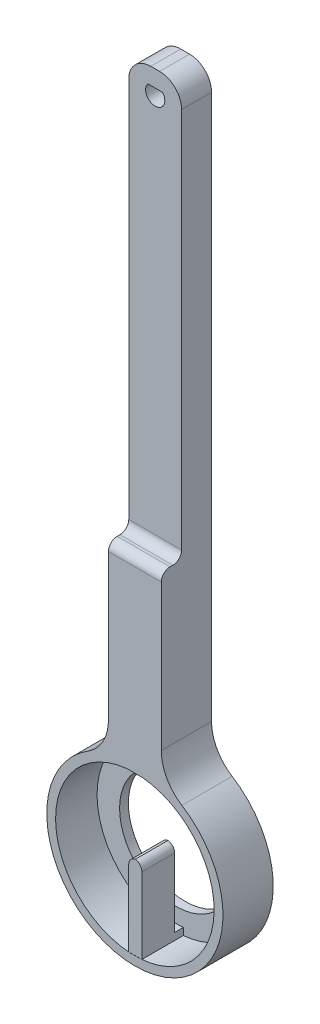
from build123d import *
from build123d.topology import SkipClean

# Parameters (mm, degrees)
BOSS_EXTRUDE1_DEPTH      = 13
BOSS_EXTRUDE1_2_DEPTH    = 13
BOSS_EXTRUDE2_DEPTH      = 13
CUT_EXTRUDE1_DEPTH       = 13
SKETCH3_W                = 6.626848164
SKETCH3_H                = 19.420298156
CUT_EXTRUDE2_DEPTH       = 13
FILLET1_R                = 10
SKETCH4_R                = 20
BOSS_EXTRUDE3_DEPTH      = 13
CUT_EXTRUDE3_DEPTH       = 13
SKETCH6_R                = 18
CUT_EXTRUDE4_DEPTH       = 24
BOSS_EXTRUDE7_DEPTH      = 22
FILLET5_R                = 1.75
FILLET6_R                = 20
SKETCH13_W               = 6.626848164
SKETCH13_H               = 84.326545424
CUT_EXTRUDE8_DEPTH       = 22
FILLET8_R                = 21.5
FILLET9_R                = 21.5
SKETCH14_W               = 17.060891399
SKETCH14_H               = 46.716771418
CUT_EXTRUDE10_DEPTH      = 22
SKETCH23_R               = 16.395826628
CUT_EXTRUDE14_DEPTH      = 4
BOSS_EXTRUDE16_DEPTH     = 2
SKETCH25_R               = 20.128500803
CUT_EXTRUDE15_DEPTH      = 9
SKETCH26_W               = 8.848519257
SKETCH26_H               = 26
CUT_EXTRUDE16_DEPTH      = 9
CUT_EXTRUDE17_DEPTH      = 9
FILLET21_R               = 3.5
SKETCH28_W               = 12
SKETCH28_H               = 42.572003563
BOSS_EXTRUDE20_DEPTH     = 15.8
BOSS_EXTRUDE21_START     = -6.8
SKETCH30_W               = 12
SKETCH30_H               = 93.599870645
BOSS_EXTRUDE21_DEPTH     = 6.8
FILLET23_R               = 5
BOSS_EXTRUDE22_DEPTH     = 6.8
CUT_EXTRUDE18_DEPTH      = 29
CUT_EXTRUDE18_DEPTH_BACK = 41
SKETCH34_W               = 5.585914081
SKETCH34_H               = 80.48337208
FILLET27_R               = 2
FILLET28_R               = 10
BOSS_EXTRUDE24_DEPTH     = 6.8


with BuildPart() as part:
    # Sketch1 → Boss-Extrude1 (new body)
    with BuildSketch(Plane.XY):
        with BuildLine():
            Line((4, -87.5), (-4, -87.5))
            Line((-4, -87.5), (-4, -67.904082058))
            ThreePointArc((-4, -67.904082058), (0, -107.5), (4, -67.904082058))
            Line((4, -67.904082058), (4, -87.5))
        make_face()
    extrude(amount=BOSS_EXTRUDE1_DEPTH)



with BuildPart() as body_2:
    # Sketch1 → Boss-Extrude1 2 (new body)
    with BuildSketch(Plane.XY):
        with BuildLine():
            Line((-4, 87.5), (-4, -67.904082058))
            ThreePointArc((-4, -67.904082058), (0, -67.5), (4, -67.904082058))
            Line((4, -67.904082058), (4, 87.5))
            ThreePointArc((4, 87.5), (0, 91.5), (-4, 87.5))
        make_face()
    extrude(amount=BOSS_EXTRUDE1_2_DEPTH)


with BuildPart() as part_1:
    add(part.part)

    add(body_2.part)  # Boss-Extrude2 merges body 2
    # Sketch1<3> → Boss-Extrude2 (add)
    with BuildSketch(Plane.XY):
        with BuildLine():
            Line((-4, -67.904082058), (-4, -87.5))
            Line((-4, -87.5), (4, -87.5))
            Line((4, -87.5), (4, -67.904082058))
            ThreePointArc((4, -67.904082058), (0, -67.5), (-4, -67.904082058))
        make_face()
        with BuildLine():
            Line((4, -87.5), (-4, -87.5))
            Line((-4, -87.5), (-4, -67.904082058))
            ThreePointArc((-4, -67.904082058), (-12.649110641, -102.991933385), (20, -87.5))
            ThreePointArc((20, -87.5), (15.491933385, -74.850889359), (4, -67.904082058))
            Line((4, -67.904082058), (4, -87.5))
        make_face()
    extrude(amount=BOSS_EXTRUDE2_DEPTH)

    # Sketch2 → Cut-Extrude1 (cut)
    with BuildSketch(Plane.XY.offset(13)):
        with BuildLine():
            Line((1.836704547, 90.02826846), (-1.836704547, 90.02826846))
            ThreePointArc((-1.836704547, 90.02826846), (-1.418788795, 84.715639507), (3.125, 87.5))
            ThreePointArc((3.125, 87.5), (2.784360493, 88.918788795), (1.836704547, 90.02826846))
        make_face()
    extrude(amount=-CUT_EXTRUDE1_DEPTH, mode=Mode.SUBTRACT)

    # Sketch3 → Cut-Extrude2 (cut)
    with BuildSketch(Plane(origin=(4, 0, 0), x_dir=(0, 0, -1), z_dir=(1, 0, 0))):
        with Locations((-9.686575918, 81.789850922)):
            Rectangle(SKETCH3_W, SKETCH3_H)
    extrude(amount=-CUT_EXTRUDE2_DEPTH, mode=Mode.SUBTRACT)

    # Fillet1
    # the kernel refuses this fillet: 10 mm, written as the material it adds along each edge
    with BuildSketch(Plane(origin=(4, 72.079701844, 6.373151836), x_dir=(0, 1, 0), z_dir=(-1, 0, 0))) as fillet1_piece_1:
        with BuildLine():
            CenterArc((9.413917712, -10), FILLET1_R, 90, 70.286615286)
            Line((0, -6.626848164), (-0.188278354, -6.559385127))
            ThreePointArc((-0.188278354, -6.559385127), (-0.2, -3.313424082), (-0.2, 0))
            Line((-0.2, 0), (0, 0.2))
            Line((0, 0.2), (9.413917712, 0.2))
            Line((9.413917712, 0.2), (9.413917712, 0))
        make_face()
    extrude(amount=8)

    # Sketch4 → Boss-Extrude3 (add)
    with BuildSketch(Plane.XY.offset(13)):
        with Locations(Location((0, -87.5, 0), (0, 0, 101.536959033))):
            Circle(SKETCH4_R)
    extrude(amount=BOSS_EXTRUDE3_DEPTH)

    # Sketch5 → Cut-Extrude3 (cut)
    with BuildSketch(Plane(origin=(4, 0, 0), x_dir=(0, 0, -1), z_dir=(1, 0, 0))):
        with BuildLine():
            Line((-13, 61.057159029), (-13, 87.5))
            Line((-13, 87.5), (-6.373151836, 87.5))
            ThreePointArc((-6.373151836, 87.5), (-7.529351989, 73.73795699), (-13, 61.057159029))
        make_face()
    extrude(amount=-CUT_EXTRUDE3_DEPTH, mode=Mode.SUBTRACT)

    # Sketch6 → Cut-Extrude4 (cut)
    with BuildSketch(Plane.XY.offset(26)):
        with Locations((0, -87.5)):
            Circle(SKETCH6_R)
    extrude(amount=-CUT_EXTRUDE4_DEPTH, mode=Mode.SUBTRACT)

    # Fillet6
    fillet6_edges = [part_1.edges().sort_by_distance(p)[0] for p in [
        (0, 61.057159029, 13),
    ]]
    fillet(fillet6_edges, radius=FILLET6_R)

    # Sketch13 → Cut-Extrude8 (cut)
    with BuildSketch(Plane.ZY.offset(4)):
        with Locations((9.686575918, 45.336727288)):
            Rectangle(SKETCH13_W, SKETCH13_H)
    extrude(amount=-CUT_EXTRUDE8_DEPTH, mode=Mode.SUBTRACT)

    # Fillet8
    # the kernel refuses this fillet: 21.5 mm, written as the material it adds along each edge
    with BuildSketch(Plane(origin=(-4, 3.173454576, 6.373151836), x_dir=(0, 1, 0), z_dir=(1, 0, 0))) as fillet8_piece_1:
        with BuildLine():
            CenterArc((15.525442166, 21.5), FILLET8_R, 223.770740898, 46.229259102)
            Line((0, 6.626848164), (-0.310508843, 6.329385127))
            ThreePointArc((-0.310508843, 6.329385127), (-0.43, 3.313424082), (-0.43, 0))
            Line((-0.43, 0), (0, -0.43))
            Line((0, -0.43), (15.525442166, -0.43))
            Line((15.525442166, -0.43), (15.525442166, 0))
        make_face()
    extrude(amount=8)

    # Fillet9
    fillet9_edges = [part_1.edges().sort_by_distance(p)[0] for p in [
        (0, 3.173454576, 13),
    ]]
    fillet(fillet9_edges, radius=FILLET9_R)

    # Sketch14 → Cut-Extrude10 (cut)
    with BuildSketch(Plane.ZY.offset(4)):
        with Locations((14.903597536, -4.659488967)):
            Rectangle(SKETCH14_W, SKETCH14_H)
    extrude(amount=-CUT_EXTRUDE10_DEPTH, mode=Mode.SUBTRACT)


with BuildPart() as body_2_2:
    # Sketch8 → Boss-Extrude7 (new body)
    with BuildSketch(Plane.XY.offset(2)):
        Polygon((-1.390650573, -105.446199904), (-1.390650573, -86.446199904), (1.609349427, -86.446199904), (1.609349427, -105.427911045), align=None)
    extrude(amount=BOSS_EXTRUDE7_DEPTH)

    # Fillet5
    # the kernel refuses this fillet: 1.75 mm, written as the material it takes off along each edge
    with BuildSketch(Plane(origin=(1.609349427, -86.446199904, -2.375), x_dir=(-1, 0, 0), z_dir=(0, 0, 1)), Plane(origin=(-1.390650573, -86.446199904, -2.375), x_dir=(0, -1, 0), z_dir=(0, 0, 1))) as fillet5_piece_1:
        with BuildLine():
            CenterArc((FILLET5_R, FILLET5_R), FILLET5_R, 180, 90)
            Line((0, FILLET5_R), (0, 0))
            Line((0, 0), (FILLET5_R, 0))
        make_face()
    extrude(amount=30.75, mode=Mode.SUBTRACT)


with BuildPart() as cut_extrude14_tool:
    # Sketch23 → Cut-Extrude14 (new body)
    with BuildSketch(Plane(origin=(0, 0, 0), x_dir=(-1, 0, 0), z_dir=(0, 0, -1))):
        with Locations((0, -87.5)):
            Circle(SKETCH23_R)
    extrude(amount=-CUT_EXTRUDE14_DEPTH)


with BuildPart() as part_2:
    add(part_1.part)

    # Cut-Extrude14: cut by cut_extrude14_tool
    add(cut_extrude14_tool.part, mode=Mode.SUBTRACT)

    # Sketch24 → Boss-Extrude16 (add)
    with BuildSketch(Plane(origin=(0, 0, 0), x_dir=(-1, 0, 0), z_dir=(0, 0, -1))):
        with BuildLine():
            ThreePointArc((0, -71.104173372), (-16.395826628, -87.5), (0, -103.895826628))
            ThreePointArc((0, -103.895826628), (16.395826628, -87.5), (0, -71.104173372))
        make_face()
        with BuildLine():
            ThreePointArc((0, -74.744099259), (12.884401545, -87.628500803), (0, -100.512902348))
            ThreePointArc((0, -100.512902348), (-12.884401545, -87.628500803), (0, -74.744099259))
        make_face(mode=Mode.SUBTRACT)
    extrude(amount=-BOSS_EXTRUDE16_DEPTH)


with BuildPart() as body_2_2_1:
    add(body_2_2.part)

    # Cut-Extrude14: cut by cut_extrude14_tool
    add(cut_extrude14_tool.part, mode=Mode.SUBTRACT)


with BuildPart() as cut_extrude15_tool:
    # Sketch25 → Cut-Extrude15 (new body)
    with BuildSketch(Plane.XY.offset(26)):
        with Locations((0, -87.628500803)):
            Circle(SKETCH25_R)
    extrude(amount=-CUT_EXTRUDE15_DEPTH)


with BuildPart() as part_3:
    add(part_2.part)

    # Cut-Extrude15: cut by cut_extrude15_tool
    add(cut_extrude15_tool.part, mode=Mode.SUBTRACT)

    # Sketch26 → Cut-Extrude16 (cut)
    with BuildSketch(Plane.XY.offset(6.373151836)):
        with Locations((0.424259629, 79.373396417)):
            Rectangle(SKETCH26_W, SKETCH26_H)
    extrude(amount=-CUT_EXTRUDE16_DEPTH, mode=Mode.SUBTRACT)

    # Sketch27 → Cut-Extrude17 (cut)
    with BuildSketch(Plane.XY.offset(6.373151836)):
        with BuildLine():
            Line((2.132304127, 63.840504789), (-2.132304127, 63.840504789))
            ThreePointArc((-2.132304127, 63.840504789), (-1.329315567, 58.476984755), (3.22736468, 61.417869469))
            ThreePointArc((3.22736468, 61.417869469), (2.940884714, 62.747185037), (2.132304127, 63.840504789))
        make_face()
    extrude(amount=-CUT_EXTRUDE17_DEPTH, mode=Mode.SUBTRACT)

    # Fillet21
    fillet21_edges = [part_3.edges().sort_by_distance(p)[0] for p in [
        (4, 66.373396417, 3.186575918),
        (-4, 66.373396417, 3.186575918),
    ]]
    fillet(fillet21_edges, radius=FILLET21_R)

    # Sketch28 → Boss-Extrude20 (add)
    with BuildSketch(Plane(origin=(0, 0, 0), x_dir=(-1, 0, 0), z_dir=(0, 0, -1))):
        with Locations((0, -48.302629702)):
            Rectangle(SKETCH28_W, SKETCH28_H)
    extrude(amount=-BOSS_EXTRUDE20_DEPTH)

    # Sketch30 → Boss-Extrude21 (add)
    with SkipClean():  # the faces are left unmerged after this step: merging them gives an invalid solid
        with BuildSketch(Plane(origin=(0, 0, 0), x_dir=(-1, 0, 0), z_dir=(0, 0, -1)).offset(BOSS_EXTRUDE21_START)):
            with Locations((0, 19.783307403)):
                Rectangle(SKETCH30_W, SKETCH30_H)
            with BuildLine():
                Line((2.132304127, 63.840504789), (-2.132304127, 63.840504789))
                ThreePointArc((-2.132304127, 63.840504789), (0, 58.190504789), (2.132304127, 63.840504789))
            make_face(mode=Mode.SUBTRACT)
        extrude(amount=BOSS_EXTRUDE21_DEPTH)

    # Fillet23
    fillet23_edges = [part_3.edges().sort_by_distance(p)[0] for p in [
        (6, 66.583242725, 3.4),
        (-6, 66.583242725, 3.4),
    ]]
    fillet(fillet23_edges, radius=FILLET23_R)

    # Sketch33 → Boss-Extrude22 (add)
    with BuildSketch(Plane.XY.offset(6.8)):
        with BuildLine():
            Line((-2.132304127, 63.840504789), (2.132304127, 63.840504789))
            ThreePointArc((2.132304127, 63.840504789), (0, 58.190504789), (-2.132304127, 63.840504789))
        make_face()
        with BuildLine():
            Line((-2.09926937, 63.802972072), (2.09926937, 63.802972072))
            ThreePointArc((2.09926937, 63.802972072), (0, 58.240504789), (-2.09926937, 63.802972072))
        make_face(mode=Mode.SUBTRACT)
    extrude(amount=-BOSS_EXTRUDE22_DEPTH)


with BuildPart() as body_2_2_2:
    add(body_2_2_1.part)

    # Cut-Extrude15: cut by cut_extrude15_tool
    add(cut_extrude15_tool.part, mode=Mode.SUBTRACT)


with BuildPart() as cut_extrude18_tool:
    # Sketch34 → Cut-Extrude18 (new, two sides: drawn at the far end of the back side and taken through both)
    with BuildSketch(Plane.ZY.offset(6).offset(-CUT_EXTRUDE18_DEPTH_BACK)):
        with Locations((14.20704296, -67.25831396)):
            Rectangle(SKETCH34_W, SKETCH34_H)
    extrude(amount=CUT_EXTRUDE18_DEPTH + CUT_EXTRUDE18_DEPTH_BACK)


with BuildPart() as part_4:
    add(part_3.part)

    # Cut-Extrude18: cut by cut_extrude18_tool
    add(cut_extrude18_tool.part, mode=Mode.SUBTRACT)

    # Fillet27
    fillet27_edges = [part_4.edges().sort_by_distance(p)[0] for p in [
        (0, -27.01662792, 6.8),
        (0, -27.01662792, 11.414085919),
    ]]
    fillet(fillet27_edges, radius=FILLET27_R)

    # Fillet28
    fillet28_edges = [part_4.edges().sort_by_distance(p)[0] for p in [
        (6, -68.421215972, 5.707042959),
        (-6, -68.421215972, 5.707042959),
    ]]
    fillet(fillet28_edges, radius=FILLET28_R)

    # Sketch35 → Boss-Extrude24 (add)
    with BuildSketch(Plane.XY.offset(6.8)):
        with BuildLine():
            Line((2.09926937, 63.802972072), (-2.09926937, 63.802972072))
            ThreePointArc((-2.09926937, 63.802972072), (0, 58.240504789), (2.09926937, 63.802972072))
        make_face()
        with BuildLine():
            Line((1.680002301, 62.802972072), (-1.680002301, 62.802972072))
            ThreePointArc((-1.680002301, 62.802972072), (0, 59.240504789), (1.680002301, 62.802972072))
        make_face(mode=Mode.SUBTRACT)
    extrude(amount=-BOSS_EXTRUDE24_DEPTH)


with BuildPart() as body_2_2_3:
    add(body_2_2_2.part)

    # Cut-Extrude18: cut by cut_extrude18_tool
    add(cut_extrude18_tool.part, mode=Mode.SUBTRACT)


solid = Compound([part_4.part, body_2_2_3.part])
